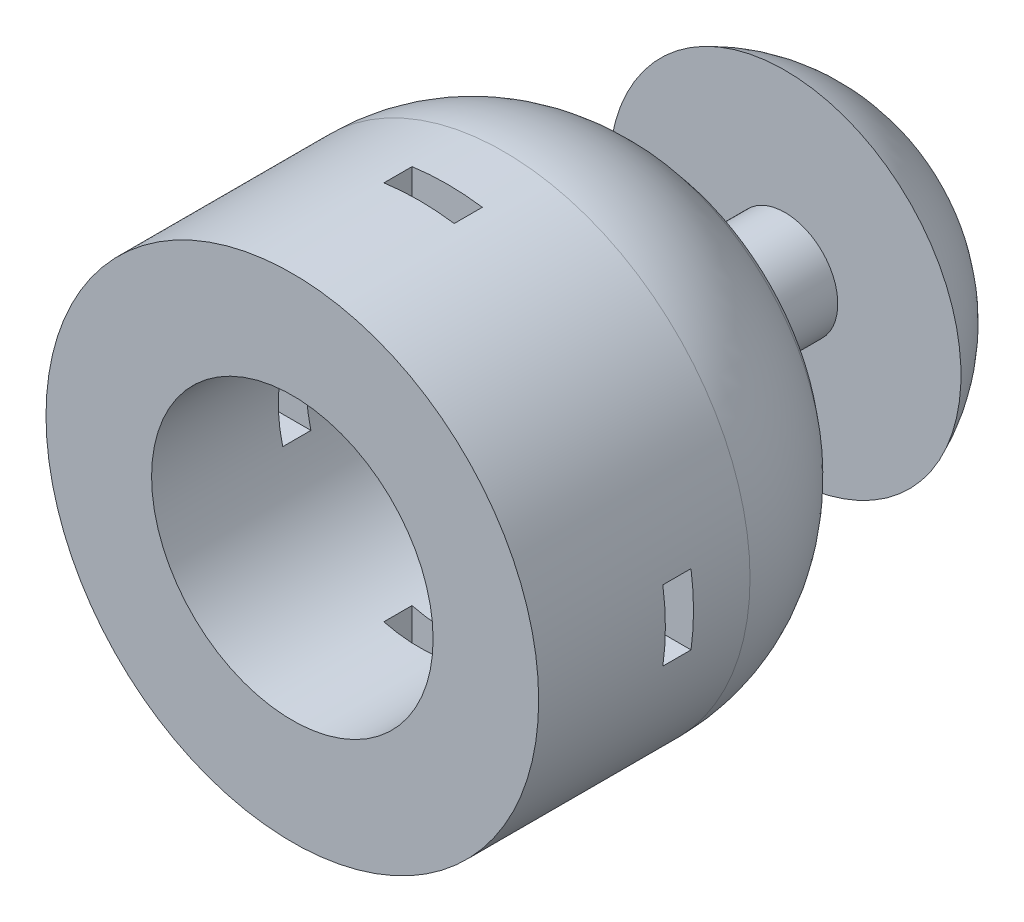
from build123d import *

# Parameters (mm, degrees)
SKETCH1_R               = 350
SKETCH1_R_2             = 200
BOSS_EXTRUDE2_DEPTH     = 400
CUT_EXTRUDE2_DEPTH      = 637.396103068
CUT_EXTRUDE2_DEPTH_BACK = 637.396103068
SKETCH2_W               = 100
SKETCH2_H               = 40
CUT_EXTRUDE3_DEPTH      = 637.396103068
CUT_EXTRUDE3_DEPTH_BACK = 637.396103068
SKETCH3_W               = 40
SKETCH3_H               = 100
BOSS_EXTRUDE3_START     = 10
SKETCH6_R               = 350
BOSS_EXTRUDE3_DEPTH     = 10
SKETCH7_R               = 75
BOSS_EXTRUDE4_DEPTH     = 150
SKETCH9_R               = 250
BOSS_EXTRUDE5_DEPTH     = 150
FILLET1_R               = 250
FILLET3_R               = 250
FILLET4_R               = 250


with BuildPart() as part:
    # Sketch1 → Boss-Extrude2 (new body)
    with BuildSketch(Plane.XY):
        Circle(SKETCH1_R)
        Circle(SKETCH1_R_2, mode=Mode.SUBTRACT)
    extrude(amount=BOSS_EXTRUDE2_DEPTH)

    # Sketch2 → Cut-Extrude2 (cut, two sides: drawn at the far end of the back side and taken through both)
    with BuildSketch(Plane(origin=(0, 0, 0), x_dir=(1, 0, 0), z_dir=(0, 1, 0)).offset(-CUT_EXTRUDE2_DEPTH_BACK)):
        with Locations((0, -200)):
            Rectangle(SKETCH2_W, SKETCH2_H)
    extrude(amount=CUT_EXTRUDE2_DEPTH + CUT_EXTRUDE2_DEPTH_BACK, mode=Mode.SUBTRACT)

    # Sketch3 → Cut-Extrude3 (cut, two sides: drawn at the far end of the back side and taken through both)
    with BuildSketch(Plane(origin=(0, 0, 0), x_dir=(0, 0, -1), z_dir=(1, 0, 0)).offset(-CUT_EXTRUDE3_DEPTH_BACK)):
        with Locations((-200, 0)):
            Rectangle(SKETCH3_W, SKETCH3_H)
    extrude(amount=CUT_EXTRUDE3_DEPTH + CUT_EXTRUDE3_DEPTH_BACK, mode=Mode.SUBTRACT)

    # Sketch6 → Boss-Extrude3 (add)
    with BuildSketch(Plane(origin=(0, 0, 0), x_dir=(-1, 0, 0), z_dir=(0, 0, -1)).offset(BOSS_EXTRUDE3_START)):
        Circle(SKETCH6_R)
    extrude(amount=-BOSS_EXTRUDE3_DEPTH)

    # Loft4: read off the stored shape, not the designer's step
    # Loft4: loft between two sections, ruled curve by curve
    loft4_from = [
        Edge.make_bspline([(170.39658005, -104.713922223, -150), (379.824424496, 236.079237876, -150), (39.031264397, 445.507082323, -150), (-170.39658005, 104.713922223, -150), (-379.824424496, -236.079237876, -150), (-39.031264397, -445.507082323, -150), (170.39658005, -104.713922223, -150)], [0, 0, 0, 0, 0.5, 0.5, 0.5, 1, 1, 1, 1], 3, [1, 0.333333333, 0.333333333, 1, 0.333333333, 0.333333333, 1]),
    ]
    loft4_to = [
        Edge.make_bspline([(327.249685966, -124.127527305, -10), (575.504740577, 530.371844627, -10), (-78.994631356, 778.626899238, -10), (-327.249685966, 124.127527305, -10), (-575.504740577, -530.371844627, -10), (78.994631356, -778.626899238, -10), (327.249685966, -124.127527305, -10)], [0, 0, 0, 0, 0.5, 0.5, 0.5, 1, 1, 1, 1], 3, [1, 0.333333333, 0.333333333, 1, 0.333333333, 0.333333333, 1]),
    ]
    loft4 = Solid(Shell([*[Face.make_surface_from_curves(loft4_from[k], loft4_to[k]) for k in range(1)], Face(Wire(loft4_from)), Face(Wire(loft4_to))]))
    add(loft4)

    # Sketch7 → Boss-Extrude4 (add)
    with BuildSketch(Plane(origin=(0, 0, -150), x_dir=(-1, 0, 0), z_dir=(0, 0, -1))):
        Circle(SKETCH7_R)
    extrude(amount=BOSS_EXTRUDE4_DEPTH)

    # Sketch9 → Boss-Extrude5 (add)
    with BuildSketch(Plane(origin=(0, 0, -300), x_dir=(-1, 0, 0), z_dir=(0, 0, -1))):
        Circle(SKETCH9_R)
    extrude(amount=BOSS_EXTRUDE5_DEPTH)

    # Fillet1
    # the kernel refuses this fillet: 250 mm, written as the material it takes off along each edge
    with BuildSketch(Plane(origin=(0, 0, -450), x_dir=(-1, 0, 0), z_dir=(0, -1, 0))) as fillet1_piece_1:
        with BuildLine():
            CenterArc((20.871215252, -250), FILLET1_R, 23.578178478, 66.421821522)
            Line((20.871215252, 0), (20.871215252, 5))
            Line((20.871215252, 5), (250, 5))
            Line((250, 5), (255, 0))
            ThreePointArc((255, 0), (255, -75), (254.582575695, -148))
            Line((254.582575695, -148), (250, -150))
        make_face()
    revolve(axis=Axis((0, 0, -450), (0, 0, -1)), mode=Mode.SUBTRACT)

    # Fillet3
    # the kernel refuses this fillet: 250 mm, written as the material it takes off along each edge
    with BuildSketch(Plane(origin=(0, 0, -150), x_dir=(0.8519829002496553, -0.5235696111141154, 0), z_dir=(-0.5235696111141154, -0.8519829002496553, 0))) as fillet3_piece_1:
        with BuildLine():
            CenterArc((100.318750936, 250), FILLET3_R, 270, 42.94225565)
            Line((270.633984519, 66.989833043), (274.04028919, 63.329629703))
            ThreePointArc((274.04028919, 63.329629703), (238.570984694, 30.057815333), (203.487874785, -3.582559069))
            Line((203.487874785, -3.582559069), (200, -5))
            Line((200, -5), (100.318750936, -5))
            Line((100.318750936, -5), (100.318750936, 0))
        make_face()
    revolve(axis=Axis((0, 0, -150), (0, 0, 1)), mode=Mode.SUBTRACT)

    # Fillet4
    # the kernel refuses this fillet: 250 mm, written as the material it takes off along each edge
    with BuildSketch(Plane(origin=(0, 0, -10), x_dir=(-1, 0, 0), z_dir=(0, -1, 0))) as fillet4_piece_1:
        with BuildLine():
            CenterArc((100, -109.702841138), FILLET4_R, 0, 46.957870566)
            Line((350, -109.702841138), (355, -109.702841138))
            Line((355, -109.702841138), (355, 0))
            Line((355, 0), (353.36883922, 3.694715457))
            ThreePointArc((353.36883922, 3.694715457), (313.60959417, 40.086717001), (274.046664209, 76.664427119))
            Line((274.046664209, 76.664427119), (270.633984518, 73.010166957))
        make_face()
    revolve(axis=Axis((0, 0, -10), (0, 0, -1)), revolution_arc=200.772, mode=Mode.SUBTRACT)
    with BuildSketch(Plane(origin=(0, 0, -10), x_dir=(0.9349991027611482, -0.35465007801472115, 0), z_dir=(0.35465007801472115, 0.9349991027611482, 0))) as fillet4_piece_2:
        with BuildLine():
            CenterArc((100, -109.702841138), FILLET4_R, 0, 46.957870566)
            Line((350, -109.702841138), (355, -109.702841138))
            Line((355, -109.702841138), (355, 0))
            Line((355, 0), (353.36883922, 3.694715457))
            ThreePointArc((353.36883922, 3.694715457), (313.60959417, 40.086717001), (274.046664209, 76.664427119))
            Line((274.046664209, 76.664427119), (270.633984519, 73.010166957))
        make_face()
    revolve(axis=Axis((0, 0, -10), (0, 0, -1)), revolution_arc=159.228, mode=Mode.SUBTRACT)


solid = part.part
